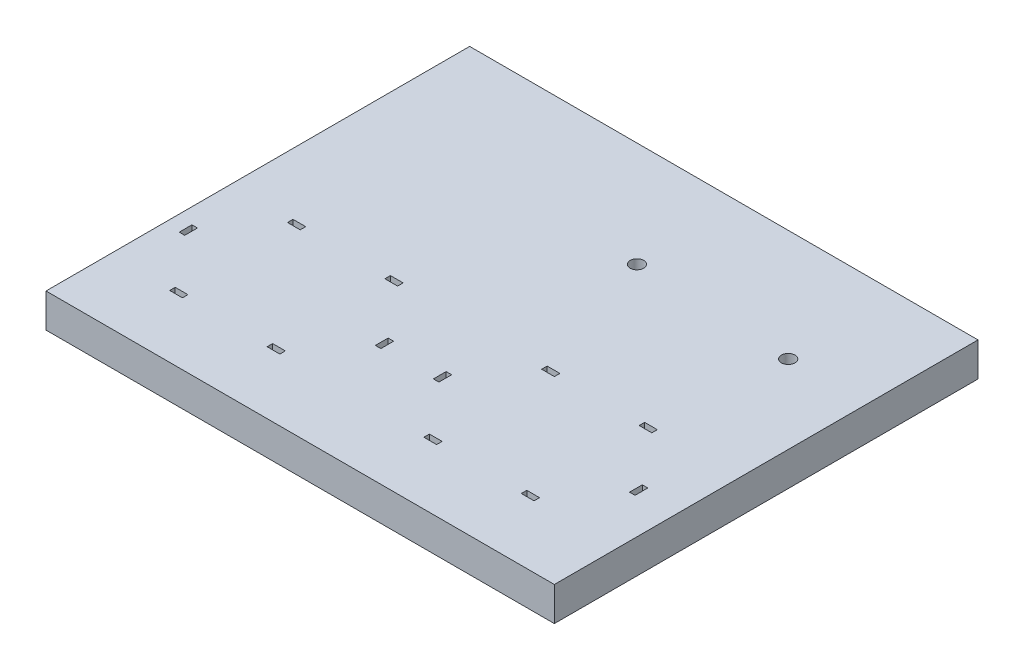
from build123d import *

# Parameters (mm, degrees)
SKETCH1_W           = 120
SKETCH1_H           = 100
SKETCH1_R           = 1.6
SKETCH1_W_2         = 3
SKETCH1_H_2         = 1.3
SKETCH1_W_3         = 1.3
SKETCH1_H_3         = 3
BOSS_EXTRUDE1_DEPTH = 8


with BuildPart() as part:
    # Sketch1 → Boss-Extrude1 (new body)
    with BuildSketch(Plane(origin=(0, 0, 0), x_dir=(1, 0, 0), z_dir=(0, 1, 0))):
        Rectangle(SKETCH1_W, SKETCH1_H)
        with Locations((41.5, 23.7)):
            Circle(SKETCH1_R, mode=Mode.SUBTRACT)
        with Locations((4.3, 25.2)):
            Circle(SKETCH1_R, mode=Mode.SUBTRACT)
        with Locations((39, -6.85)):
            Rectangle(SKETCH1_W_2, SKETCH1_H_2, mode=Mode.SUBTRACT)
        with Locations((16, -6.85)):
            Rectangle(SKETCH1_W_2, SKETCH1_H_2, mode=Mode.SUBTRACT)
        with Locations((4.35, -20.75)):
            Rectangle(SKETCH1_W_3, SKETCH1_H_3, mode=Mode.SUBTRACT)
        with Locations((50.65, -20.75)):
            Rectangle(SKETCH1_W_3, SKETCH1_H_3, mode=Mode.SUBTRACT)
        with Locations((39, -34.65)):
            Rectangle(SKETCH1_W_2, SKETCH1_H_2, mode=Mode.SUBTRACT)
        with Locations((16, -34.65)):
            Rectangle(SKETCH1_W_2, SKETCH1_H_2, mode=Mode.SUBTRACT)
        with Locations((-21, -34.65)):
            Rectangle(SKETCH1_W_2, SKETCH1_H_2, mode=Mode.SUBTRACT)
        with Locations((-44, -34.65)):
            Rectangle(SKETCH1_W_2, SKETCH1_H_2, mode=Mode.SUBTRACT)
        with Locations((-55.65, -20.75)):
            Rectangle(SKETCH1_W_3, SKETCH1_H_3, mode=Mode.SUBTRACT)
        with Locations((-44, -6.85)):
            Rectangle(SKETCH1_W_2, SKETCH1_H_2, mode=Mode.SUBTRACT)
        with Locations((-9.35, -20.75)):
            Rectangle(SKETCH1_W_3, SKETCH1_H_3, mode=Mode.SUBTRACT)
        with Locations((-21, -6.85)):
            Rectangle(SKETCH1_W_2, SKETCH1_H_2, mode=Mode.SUBTRACT)
    extrude(amount=BOSS_EXTRUDE1_DEPTH)


solid = part.part
